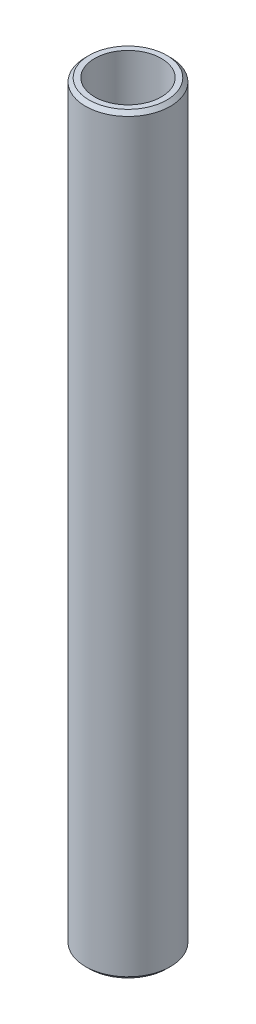
from build123d import *

# Parameters (mm, degrees)
SKETCH1_R           = 32.5
BOSS_EXTRUDE1_DEPTH = 576.555281837
SKETCH2_R           = 25.576815211
CUT_EXTRUDE1_DEPTH  = 579.384381717
CHAMFER1_SIZE       = 2.772542658


with BuildPart() as part:
    # Sketch1 → Boss-Extrude1 (new body)
    with BuildSketch(Plane(origin=(0, 0, 0), x_dir=(1, 0, 0), z_dir=(0, 1, 0))):
        Circle(SKETCH1_R)
    extrude(amount=BOSS_EXTRUDE1_DEPTH)

    # Sketch2 → Cut-Extrude1 (cut, through all)
    with BuildSketch(Plane(origin=(0, 0, 0), x_dir=(1, 0, 0), z_dir=(0, 1, 0))):
        Circle(SKETCH2_R)
    extrude(amount=CUT_EXTRUDE1_DEPTH, mode=Mode.SUBTRACT)

    # Chamfer1
    chamfer1_edges = [part.edges().sort_by_distance(p)[0] for p in [
        (-32.5, 576.555281837, 0),
        (-32.5, 0, 0),
    ]]
    chamfer(chamfer1_edges, length=CHAMFER1_SIZE)


solid = part.part
